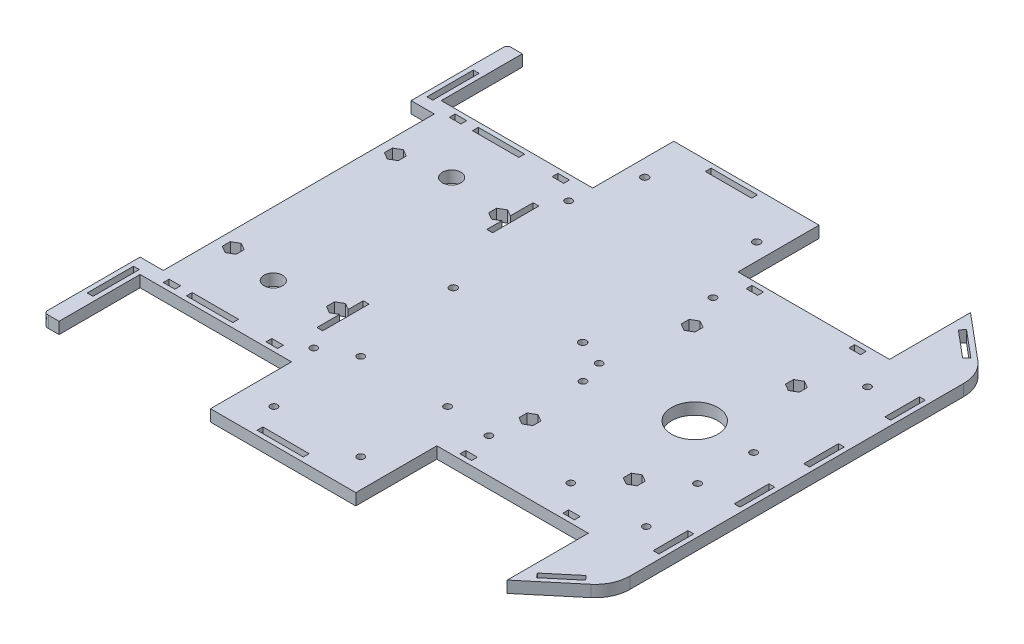
from build123d import *

# Parameters (mm, degrees)
SKETCH1_W           = 2.5
SKETCH1_H           = 20
SKETCH1_W_2         = 5
SKETCH1_H_2         = 2.5
SKETCH1_W_3         = 20
SKETCH1_R           = 1.5
SKETCH1_H_3         = 15
SKETCH1_R_2         = 1.6
SKETCH1_R_3         = 10
SKETCH1_R_4         = 4
BOSS_EXTRUDE1_DEPTH = 2.5
FILLET1_SIZE        = 2
FILLET2_R           = 15


with BuildPart() as part:
    # Sketch1 → Boss-Extrude1 (new, symmetric)
    with BuildSketch(Plane(origin=(0, 0, 0), x_dir=(1, 0, 0), z_dir=(0, 1, 0))):
        Polygon((100, -65), (100, -100), (125, -79.022509221), (125, 79.022509221), (100, 100), (100, 65), (34.617, 65), (34.617, 100), (-28.117, 100), (-28.117, 65), (-93.5, 65), (-93.5, 100), (-100, 100), (-100, 58.5), (-90, 58.5), (-90, -58.5), (-100, -58.5), (-100, -100), (-93.5, -100), (-93.5, -65), (-28.117, -65), (-28.117, -100), (34.617, -100), (34.617, -65), align=None)
        Polygon((-35.5, 36.842613384), (-35.5, 46.666666667), (-33, 46.666666667), (-33, 26.666666667), (-35.5, 26.666666667), (-35.5, 33.157386616), (-38.3085, 31.535898385), (-41.3085, 33.267949192), (-41.3085, 36.732050808), (-38.3085, 38.464101615), align=None, mode=Mode.SUBTRACT)
        Polygon((-35.5, -33.157386616), (-35.5, -26.666666667), (-33, -26.666666667), (-33, -46.666666667), (-35.5, -46.666666667), (-35.5, -36.842613384), (-38.3085, -38.464101615), (-41.3085, -36.732050808), (-41.3085, -33.267949192), (-38.3085, -31.535898385), align=None, mode=Mode.SUBTRACT)
        with Locations((-96.75, -73.333333333)):
            Rectangle(SKETCH1_W, SKETCH1_H, mode=Mode.SUBTRACT)
        with Locations((-83, -61.75)):
            Rectangle(SKETCH1_W_2, SKETCH1_H_2, mode=Mode.SUBTRACT)
        with Locations((-65.5, -61.75)):
            Rectangle(SKETCH1_W_3, SKETCH1_H_2, mode=Mode.SUBTRACT)
        with Locations((0, -96.75)):
            Rectangle(SKETCH1_W_3, SKETCH1_H_2, mode=Mode.SUBTRACT)
        with Locations(Location((-15.248, -85.5, 0), (0, 0, 270))):
            Circle(SKETCH1_R, mode=Mode.SUBTRACT)
        with Locations((-38.617, -61.75)):
            Rectangle(SKETCH1_W_2, SKETCH1_H_2, mode=Mode.SUBTRACT)
        with Locations(Location((-28.5, -55, 0), (0, 0, 270))):
            Circle(SKETCH1_R, mode=Mode.SUBTRACT)
        with Locations(Location((-15.248, -48, 0), (0, 0, 270))):
            Circle(SKETCH1_R, mode=Mode.SUBTRACT)
        with Locations(Location((22.252, -85.5, 0), (0, 0, 270))):
            Circle(SKETCH1_R, mode=Mode.SUBTRACT)
        with Locations((45.117, -61.75)):
            Rectangle(SKETCH1_W_2, SKETCH1_H_2, mode=Mode.SUBTRACT)
        Polygon((105.469091457, -92.800072797), (103.862122433, -90.884961689), (115.35278908, -81.243147544), (116.959758104, -83.158258651), align=None, mode=Mode.SUBTRACT)
        with Locations(Location((77.441, -50, 0), (0, 0, 270))):
            Circle(SKETCH1_R, mode=Mode.SUBTRACT)
        with Locations((89.5, -61.75)):
            Rectangle(SKETCH1_W_2, SKETCH1_H_2, mode=Mode.SUBTRACT)
        with Locations((121.75, -50.007009332)):
            Rectangle(SKETCH1_W, SKETCH1_H_3, mode=Mode.SUBTRACT)
        with Locations(Location((22.252, -48, 0), (0, 0, 270))):
            Circle(SKETCH1_R, mode=Mode.SUBTRACT)
        with Locations(Location((42.055, -50, 0), (0, 0, 270))):
            Circle(SKETCH1_R, mode=Mode.SUBTRACT)
        Polygon((47.8085, -36.732050808), (44.8085, -38.464101615), (41.8085, -36.732050808), (41.8085, -33.267949192), (44.8085, -31.535898385), (47.8085, -33.267949192), align=None, mode=Mode.SUBTRACT)
        with Locations(Location((42.055, -9.36, 0), (0, 0, 270))):
            Circle(SKETCH1_R, mode=Mode.SUBTRACT)
        Polygon((89.8085, -31.535898385), (92.8085, -33.267949192), (92.8085, -36.732050808), (89.8085, -38.464101615), (86.8085, -36.732050808), (86.8085, -33.267949192), align=None, mode=Mode.SUBTRACT)
        with Locations(Location((110, -50, 0), (0, 0, 270))):
            Circle(SKETCH1_R, mode=Mode.SUBTRACT)
        with Locations(Location((105, -22.822, 0), (0, 0, 270))):
            Circle(SKETCH1_R, mode=Mode.SUBTRACT)
        with Locations((121.75, -15.007009332)):
            Rectangle(SKETCH1_W, SKETCH1_H_3, mode=Mode.SUBTRACT)
        with Locations((-83, 61.75)):
            Rectangle(SKETCH1_W_2, SKETCH1_H_2, mode=Mode.SUBTRACT)
        with Locations((-96.75, 73.333333333)):
            Rectangle(SKETCH1_W, SKETCH1_H, mode=Mode.SUBTRACT)
        with Locations((-65.5, 61.75)):
            Rectangle(SKETCH1_W_3, SKETCH1_H_2, mode=Mode.SUBTRACT)
        with Locations((-38.617, 61.75)):
            Rectangle(SKETCH1_W_2, SKETCH1_H_2, mode=Mode.SUBTRACT)
        with Locations(Location((-28.5, 55, 0), (0, 0, 270))):
            Circle(SKETCH1_R, mode=Mode.SUBTRACT)
        with Locations(Location((-20.92, 80.26, 0), (0, 0, 270))):
            Circle(SKETCH1_R_2, mode=Mode.SUBTRACT)
        with Locations((0, 96.75)):
            Rectangle(SKETCH1_W_3, SKETCH1_H_2, mode=Mode.SUBTRACT)
        with Locations(Location((27.42, 5.13, 0), (0, 0, 270))):
            Circle(SKETCH1_R_2, mode=Mode.SUBTRACT)
        with Locations(Location((38.83, 0.851, 0), (0, 0, 270))):
            Circle(SKETCH1_R, mode=Mode.SUBTRACT)
        Polygon((47.8085, 36.732050808), (47.8085, 33.267949192), (44.8085, 31.535898385), (41.8085, 33.267949192), (41.8085, 36.732050808), (44.8085, 38.464101615), align=None, mode=Mode.SUBTRACT)
        with Locations(Location((80.93, 0, 0), (0, 0, 270))):
            Circle(SKETCH1_R_3, mode=Mode.SUBTRACT)
        with Locations(Location((105.5, 0.851, 0), (0, 0, 270))):
            Circle(SKETCH1_R, mode=Mode.SUBTRACT)
        with Locations((121.75, 15.007009332)):
            Rectangle(SKETCH1_W, SKETCH1_H_3, mode=Mode.SUBTRACT)
        Polygon((89.8085, 31.535898385), (86.8085, 33.267949192), (86.8085, 36.732050808), (89.8085, 38.464101615), (92.8085, 36.732050808), (92.8085, 33.267949192), align=None, mode=Mode.SUBTRACT)
        with Locations(Location((38.83, 50, 0), (0, 0, 270))):
            Circle(SKETCH1_R, mode=Mode.SUBTRACT)
        with Locations((45.117, 61.75)):
            Rectangle(SKETCH1_W_2, SKETCH1_H_2, mode=Mode.SUBTRACT)
        with Locations(Location((27.42, 80.26, 0), (0, 0, 270))):
            Circle(SKETCH1_R_2, mode=Mode.SUBTRACT)
        with Locations((89.5, 61.75)):
            Rectangle(SKETCH1_W_2, SKETCH1_H_2, mode=Mode.SUBTRACT)
        with Locations(Location((105.5, 50, 0), (0, 0, 270))):
            Circle(SKETCH1_R, mode=Mode.SUBTRACT)
        with Locations((121.75, 50.007009332)):
            Rectangle(SKETCH1_W, SKETCH1_H_3, mode=Mode.SUBTRACT)
        Polygon((116.959758104, 83.158258651), (115.35278908, 81.243147544), (103.862122433, 90.884961689), (105.469091457, 92.800072797), align=None, mode=Mode.SUBTRACT)
        with Locations(Location((-62.5, 38.5, 0), (0, 0, 270))):
            Circle(SKETCH1_R_4, mode=Mode.SUBTRACT)
        Polygon((-80.3085, 33.267949192), (-83.3085, 31.535898385), (-86.3085, 33.267949192), (-86.3085, 36.732050808), (-83.3085, 38.464101615), (-80.3085, 36.732050808), align=None, mode=Mode.SUBTRACT)
        Polygon((-86.3085, -36.732050808), (-86.3085, -33.267949192), (-83.3085, -31.535898385), (-80.3085, -33.267949192), (-80.3085, -36.732050808), (-83.3085, -38.464101615), align=None, mode=Mode.SUBTRACT)
        with Locations(Location((-62.5, -38.5, 0), (0, 0, 270))):
            Circle(SKETCH1_R_4, mode=Mode.SUBTRACT)
        with Locations(Location((-20.92, -2.37, 0), (0, 0, 270))):
            Circle(SKETCH1_R_2, mode=Mode.SUBTRACT)
    extrude(amount=BOSS_EXTRUDE1_DEPTH, both=True)

    # Fillet1
    # a fillet whose section is not a circle: 2 mm, written as the material it takes off along each edge
    with BuildSketch(Plane(origin=(-100, -7.5, -100), x_dir=(0, 0, 1), z_dir=(0, 1, 0)), Plane(origin=(-100, -7.5, 100), x_dir=(1, 0, 0), z_dir=(0, 1, 0))) as fillet1_piece_1:
        with BuildLine():
            add(Edge.make_bspline([(FILLET1_SIZE, 0), (FILLET1_SIZE * 0.831801948466, 0), (FILLET1_SIZE * 0.663603896932, 0), (FILLET1_SIZE * 0.292893218813, FILLET1_SIZE * 0.0716919198361), (FILLET1_SIZE * 0.071691919836, FILLET1_SIZE * 0.292893218813), (0, FILLET1_SIZE * 0.663603896932), (0, FILLET1_SIZE * 0.831801948466), (0, FILLET1_SIZE)], knots=[0, 0, 0, 0, 0, 0, 0.5, 0.5, 1, 1, 1, 1, 1, 1], degree=5))
            Line((0, FILLET1_SIZE), (0, 0))
            Line((0, 0), (FILLET1_SIZE, 0))
        make_face()
    extrude(amount=15, mode=Mode.SUBTRACT)

    # Fillet2
    fillet2_edges = [part.edges().sort_by_distance(p)[0] for p in [
        (125, 0, -79.022509221),
        (125, 0, 79.022509221),
    ]]
    fillet(fillet2_edges, radius=FILLET2_R)


solid = part.part
